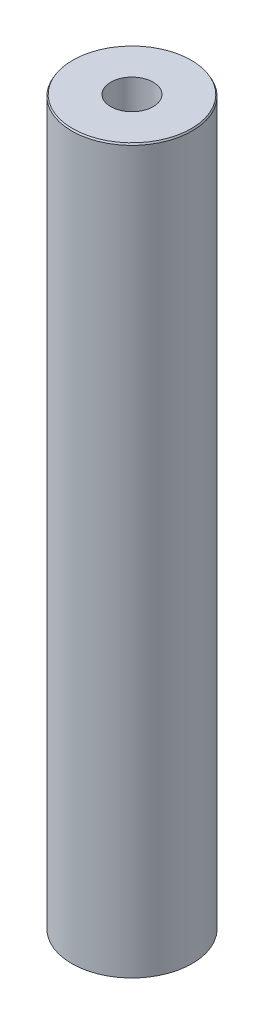
from build123d import *
from OCP.BRepFilletAPI import BRepFilletAPI_MakeChamfer

# Parameters (mm, degrees)
SKETCH1_R           = 27.5
BOSS_EXTRUDE1_DEPTH = 330.494195406
SKETCH2_R           = 9.69838327
CUT_EXTRUDE1_DEPTH  = 333.774568134
CHAMFER1_SIZE       = 0.725213341
CHAMFER1_SIZE2      = 0.418702117


with BuildPart() as part:
    # Sketch1 → Boss-Extrude1 (new body)
    with BuildSketch(Plane(origin=(0, 0, 0), x_dir=(1, 0, 0), z_dir=(0, 1, 0))):
        Circle(SKETCH1_R)
    extrude(amount=BOSS_EXTRUDE1_DEPTH)

    # Sketch2 → Cut-Extrude1 (cut, through all)
    with BuildSketch(Plane(origin=(0, 0, 0), x_dir=(1, 0, 0), z_dir=(0, 1, 0))):
        Circle(SKETCH2_R)
    extrude(amount=CUT_EXTRUDE1_DEPTH, mode=Mode.SUBTRACT)

    # Chamfer1: one chamfer whose edges measure the first distance from different faces: ONE call of the kernel's chamfer builder (chamfer() names one face for all edges)
    chamfer1_edges_1 = [part.edges().sort_by_distance(p)[0] for p in [
        (-27.5, 330.494195406, 0),
    ]]
    chamfer1_side_1 = [part.faces().sort_by_distance(p)[0] for p in [
        (-27.5, 165.247097703, 0),
    ]]
    chamfer1_edges_2 = [part.edges().sort_by_distance(p)[0] for p in [
        (-27.5, 0, 0),
    ]]
    chamfer1_side_2 = [part.faces().sort_by_distance(p)[0] for p in [
        (-26.722182541, 0, 0),
    ]]
    chamfer1 = BRepFilletAPI_MakeChamfer(part.part.solid().wrapped)
    for e in chamfer1_edges_1:
        chamfer1.Add(CHAMFER1_SIZE, CHAMFER1_SIZE2, e.wrapped, chamfer1_side_1[0].wrapped)  # the first distance lies on this face
    for e in chamfer1_edges_2:
        chamfer1.Add(CHAMFER1_SIZE, CHAMFER1_SIZE2, e.wrapped, chamfer1_side_2[0].wrapped)  # the first distance lies on this face
    add(Compound.cast(chamfer1.Shape()), mode=Mode.REPLACE)


solid = part.part
